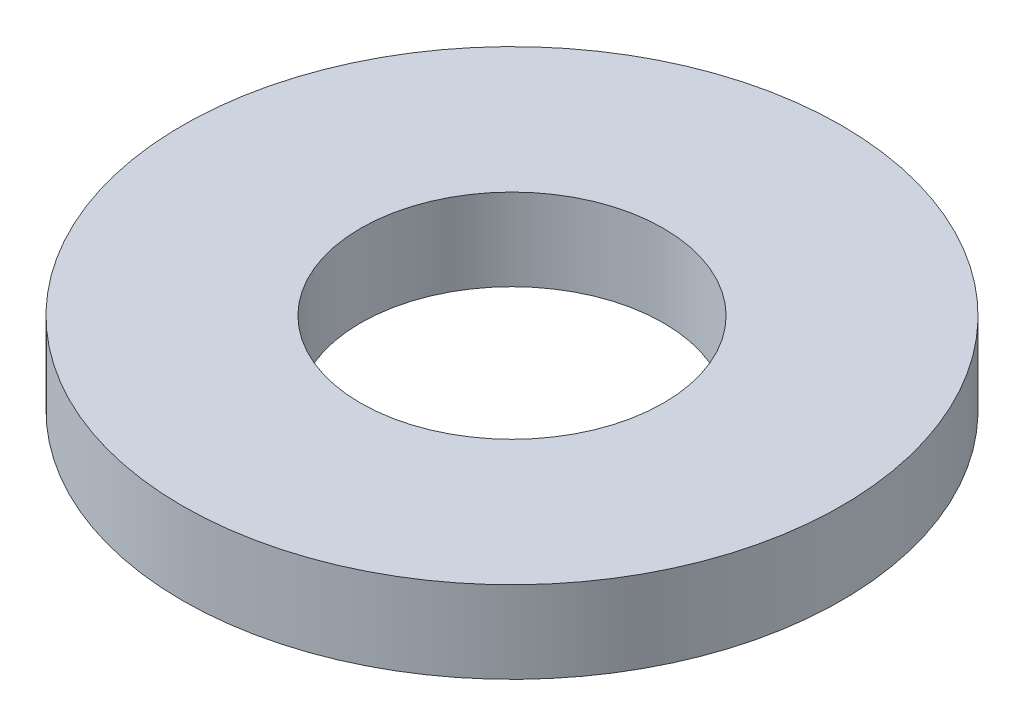
from build123d import *

# Parameters (mm, degrees)
SKETCH1_R           = 92.5
BOSS_EXTRUDE1_DEPTH = 23
SKETCH2_R           = 42.5
CUT_EXTRUDE1_DEPTH  = 133.821308531


with BuildPart() as part:
    # Sketch1 → Boss-Extrude1 (new body)
    with BuildSketch(Plane(origin=(0, 0, 0), x_dir=(1, 0, 0), z_dir=(0, 1, 0))):
        Circle(SKETCH1_R)
    extrude(amount=BOSS_EXTRUDE1_DEPTH)

    # Sketch2 → Cut-Extrude1 (cut, through all)
    with BuildSketch(Plane(origin=(0, 0, 0), x_dir=(1, 0, 0), z_dir=(0, 1, 0))):
        Circle(SKETCH2_R)
    extrude(amount=CUT_EXTRUDE1_DEPTH, mode=Mode.SUBTRACT)


solid = part.part
